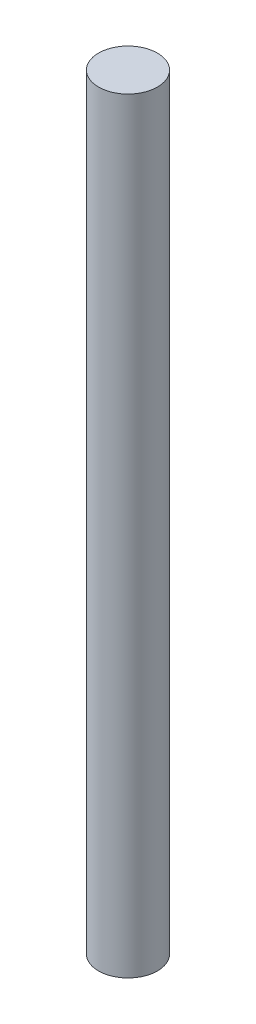
from build123d import *

# Parameters (mm, degrees)
SKETCH1_R           = 6.35
BOSS_EXTRUDE1_DEPTH = 165.1


with BuildPart() as part:
    # Sketch1 → Boss-Extrude1 (new body)
    with BuildSketch(Plane(origin=(0, 0, 0), x_dir=(1, 0, 0), z_dir=(0, 1, 0))):
        Circle(SKETCH1_R)
    extrude(amount=BOSS_EXTRUDE1_DEPTH)


solid = part.part
